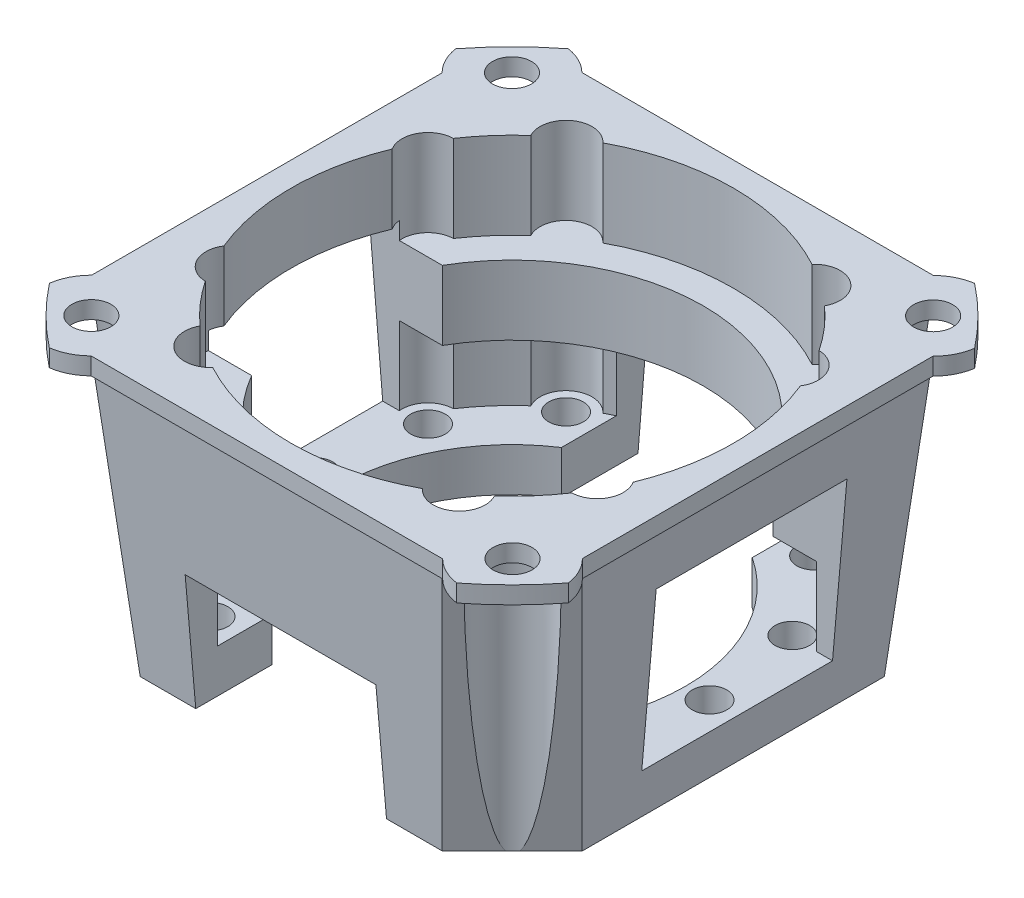
from build123d import *
from OCP.BRepFilletAPI import BRepFilletAPI_MakeChamfer

# Parameters (mm, degrees)
SKETCH1_W               = 29.5
SKETCH1_H               = 29.5
BOSS_EXTRUDE1_DEPTH     = 16
SKETCH2_R               = 12.75
CUT_EXTRUDE1_DEPTH      = 13.5
CHAMFER1_SIZE           = 22.860104606
CHAMFER1_SIZE_2         = 2
CHAMFER2_SIZE           = 4
CHAMFER2_SIZE2          = 4.030734246
SKETCH5_R               = 10
CUT_EXTRUDE2_DEPTH      = 10
BOSS_EXTRUDE2_START     = -1
BOSS_EXTRUDE2_DEPTH     = 1
MIRROR2_START           = -1
MIRROR2_COPY_1_DEPTH    = 1
CUT_EXTRUDE3_DEPTH      = 45.646312331
CUT_EXTRUDE3_DEPTH_BACK = 45.646312331
SKETCH7_R               = 1.125
SKETCH8_R               = 1
CUT_EXTRUDE4_DEPTH      = 45.992146034
SKETCH17_R              = 1.5
CUT_EXTRUDE12_DEPTH     = 13.5
SKETCH11_OUTSIDE_W      = 41.044
SKETCH11_OUTSIDE_H      = 41.014
SKETCH11_OUTSIDE_R      = 19
CUT_EXTRUDE6_DEPTH      = 45.992146034
SKETCH12_R              = 2
CUT_EXTRUDE7_DEPTH      = 15
SKETCH13_W              = 11
SKETCH13_H              = 30.855989766
CUT_EXTRUDE8_DEPTH      = 7
CUT_EXTRUDE9_DEPTH      = 45.557331201
CUT_EXTRUDE9_DEPTH_BACK = 45.557331201
SKETCH14_W              = 11
SKETCH14_H              = 9.5
BOSS_EXTRUDE4_START     = -4
BOSS_EXTRUDE4_DEPTH     = 4


with BuildPart() as part:
    # Sketch1 → Boss-Extrude1 (new body)
    with BuildSketch(Plane(origin=(0, 0, 0), x_dir=(1, 0, 0), z_dir=(0, 1, 0))):
        with Locations((14.75, 14.75)):
            Rectangle(SKETCH1_W, SKETCH1_H)
    extrude(amount=BOSS_EXTRUDE1_DEPTH)

    # Sketch2 → Cut-Extrude1 (cut)
    with BuildSketch(Plane(origin=(0, 16, 0), x_dir=(1, 0, 0), z_dir=(0, 1, 0))):
        with Locations(Location((14.75, 14.75, 0), (0, 0, 270))):
            Circle(SKETCH2_R)
    extrude(amount=-CUT_EXTRUDE1_DEPTH, mode=Mode.SUBTRACT)

    # Chamfer1
    # the kernel refuses this chamfer: 22.860104606, 2 mm, written as the material it takes off along each edge
    with BuildSketch(Plane(origin=(-59.427907001, 0, 0), x_dir=(0, 1, 0), z_dir=(1, 0, 0)), Plane(origin=(29.5, 0, 59.427907001), x_dir=(0, 1, 0), z_dir=(0, 0, -1)), Plane(origin=(0, 0, -88.927907001), x_dir=(0, 1, 0), z_dir=(0, 0, 1))) as chamfer1_piece_1:
        Polygon((CHAMFER1_SIZE, 0), (0, -CHAMFER1_SIZE_2), (0, 0), align=None)
    extrude(amount=148.355814002, mode=Mode.SUBTRACT)
    with BuildSketch(Plane(origin=(88.927907001, 0, -29.5), x_dir=(0, 0, 1), z_dir=(-1, 0, 0))) as chamfer1_piece_2:
        Polygon((CHAMFER1_SIZE_2, 0), (0, CHAMFER1_SIZE), (0, 0), align=None)
    extrude(amount=148.355814002, mode=Mode.SUBTRACT)

    # Chamfer2: one chamfer whose edges measure the first distance from different faces: ONE call of the kernel's chamfer builder (chamfer() names one face for all edges)
    chamfer2_edges_1 = [part.edges().sort_by_distance(p)[0] for p in [
        (1.300090692, 8, -28.199909308),
        (28.199909308, 8, -28.199909308),
    ]]
    chamfer2_side_1 = [part.faces().sort_by_distance(p)[0] for p in [
        (14.75, 8.13876858, -28.212049986),
    ]]
    chamfer2_edges_2 = [part.edges().sort_by_distance(p)[0] for p in [
        (1.300090692, 8, -1.300090692),
    ]]
    chamfer2_side_2 = [part.faces().sort_by_distance(p)[0] for p in [
        (1.287950014, 8.13876858, -14.75),
    ]]
    chamfer2_edges_3 = [part.edges().sort_by_distance(p)[0] for p in [
        (28.199909308, 8, -1.300090692),
    ]]
    chamfer2_side_3 = [part.faces().sort_by_distance(p)[0] for p in [
        (28.212049986, 8.13876858, -14.75),
    ]]
    chamfer2 = BRepFilletAPI_MakeChamfer(part.part.solid().wrapped)
    for e in chamfer2_edges_1:
        chamfer2.Add(CHAMFER2_SIZE, CHAMFER2_SIZE2, e.wrapped, chamfer2_side_1[0].wrapped)  # the first distance lies on this face
    for e in chamfer2_edges_2:
        chamfer2.Add(CHAMFER2_SIZE, CHAMFER2_SIZE2, e.wrapped, chamfer2_side_2[0].wrapped)  # the first distance lies on this face
    for e in chamfer2_edges_3:
        chamfer2.Add(CHAMFER2_SIZE, CHAMFER2_SIZE2, e.wrapped, chamfer2_side_3[0].wrapped)  # the first distance lies on this face
    add(Compound.cast(chamfer2.Shape()), mode=Mode.REPLACE)

    # Sketch5 → Cut-Extrude2 (cut)
    with BuildSketch(Plane.XZ):
        with Locations(Location((14.75, -14.734574622, 0), (0, 0, 270))):
            Circle(SKETCH5_R)
    extrude(amount=-CUT_EXTRUDE2_DEPTH, mode=Mode.SUBTRACT)

    # Boss-Extrude2: read off the stored shape, not the designer's step
    # Boss-Extrude2 outline → Boss-Extrude2 (add)
    with BuildSketch(Plane(origin=(0, 16, 0), x_dir=(1, 0, 0), z_dir=(0, 1, 0)).offset(BOSS_EXTRUDE2_START)):
        with BuildLine():
            Line((0.600181384, 4.615344889), (4.646195644, 0.600181384))
            Line((4.646195644, 0.600181384), (24.853804356, 0.600181384))
            Line((24.853804356, 0.600181384), (28.899818616, 4.615344889))
            Line((28.899818616, 4.615344889), (28.899818616, 24.853804356))
            Line((28.899818616, 24.853804356), (24.884655111, 28.899818616))
            Line((24.884655111, 28.899818616), (4.615344889, 28.899818616))
            ThreePointArc((4.615344889, 28.899818616), (0.584756006, 28.884393239), (0.600181384, 24.853804356))
            Line((0.600181384, 24.853804356), (0.600181384, 4.615344889))
        make_face()
        Polygon((24.797166447, 28.812329953), (28.812329953, 24.766315692), (28.812329953, 4.702833553), (24.766315692, 0.687670047), (4.733684308, 0.687670047), (0.687670047, 4.702833553), (0.687670047, 24.766315692), (4.702833553, 28.812329953), align=None, mode=Mode.SUBTRACT)
    boss_extrude2 = extrude(amount=BOSS_EXTRUDE2_DEPTH)

    # Mirror1: Boss-Extrude2 across plane
    add(boss_extrude2.mirror(Plane(origin=(14.75, 0, 0), x_dir=(0, 0, 1), z_dir=(1, 0, 0))))

    # Mirror2: Boss-Extrude2 across plane
    add(boss_extrude2.mirror(Plane.XY.offset(-14.75)))

    # Mirror2 copy 1 sketch → Mirror2 copy 1 (add)
    with BuildSketch(Plane(origin=(29.5, 16, -29.5), x_dir=(-1, 0, 0), z_dir=(0, 1, 0)).offset(MIRROR2_START)):
        with BuildLine():
            Line((0.600181384, 4.615344889), (4.646195644, 0.600181384))
            Line((4.646195644, 0.600181384), (24.853804356, 0.600181384))
            Line((24.853804356, 0.600181384), (28.899818616, 4.615344889))
            Line((28.899818616, 4.615344889), (28.899818616, 24.853804356))
            Line((28.899818616, 24.853804356), (24.884655111, 28.899818616))
            Line((24.884655111, 28.899818616), (4.615344889, 28.899818616))
            ThreePointArc((4.615344889, 28.899818616), (0.584756006, 28.884393239), (0.600181384, 24.853804356))
            Line((0.600181384, 24.853804356), (0.600181384, 4.615344889))
        make_face()
        Polygon((24.797166447, 28.812329953), (28.812329953, 24.766315692), (28.812329953, 4.702833553), (24.766315692, 0.687670047), (4.733684308, 0.687670047), (0.687670047, 4.702833553), (0.687670047, 24.766315692), (4.702833553, 28.812329953), align=None, mode=Mode.SUBTRACT)
    extrude(amount=MIRROR2_COPY_1_DEPTH)

    # Sketch7 → Cut-Extrude3 (cut, two sides: drawn at the far end of the back side and taken through both)
    with BuildSketch(Plane.XZ.offset(-15).offset(-CUT_EXTRUDE3_DEPTH_BACK)):
        with Locations(Location((2.607763136, -2.623188514, 0), (0, 0, 270))):
            Circle(SKETCH7_R)
        with Locations(Location((26.892236864, -2.623188514, 0), (0, 0, 308.909428046))):
            Circle(SKETCH7_R)
        with Locations(Location((26.892236864, -26.876811486, 0), (0, 0, 270))):
            Circle(SKETCH7_R)
        with Locations(Location((2.607763136, -26.876811486, 0), (0, 0, 270))):
            Circle(SKETCH7_R)
    extrude(amount=CUT_EXTRUDE3_DEPTH + CUT_EXTRUDE3_DEPTH_BACK, mode=Mode.SUBTRACT)

    # Sketch8 → Cut-Extrude4 (cut, through all)
    with BuildSketch(Plane.XZ):
        with Locations(Location((7.58, -4.521537889, 0), (0, 0, 270))):
            Circle(SKETCH8_R)
        with Locations(Location((4.219388969, -9.118549755, 0), (0, 0, 270))):
            Circle(SKETCH8_R)
        with Locations(Location((7.604770426, -24.995781156, 0), (0, 0, 270))):
            Circle(SKETCH8_R)
        with Locations(Location((21.944728448, -24.96108318, 0), (0, 0, 270))):
            Circle(SKETCH8_R)
        with Locations(Location((25.294206418, -20.355953224, 0), (0, 0, 270))):
            Circle(SKETCH8_R)
        with Locations(Location((21.92, -4.521537889, 0), (0, 0, 270))):
            Circle(SKETCH8_R)
        with Locations(Location((3.375033299, -14.777523673, 0), (0, 0, 90))):
            Circle(SKETCH8_R)
        with Locations(Location((4.233046011, -20.406914295, 0), (0, 0, 245.746224718))):
            Circle(SKETCH8_R)
        with Locations(Location((26.125, -14.75, 0), (0, 0, 90))):
            Circle(SKETCH8_R)
        with Locations(Location((25.280611031, -9.118549755, 0), (0, 0, 350.665442319))):
            Circle(SKETCH8_R)
    extrude(amount=-CUT_EXTRUDE4_DEPTH, mode=Mode.SUBTRACT)

    # Sketch17 → Cut-Extrude12 (cut)
    with BuildSketch(Plane(origin=(0, 2.5, 0), x_dir=(1, 0, 0), z_dir=(0, 1, 0))):
        with Locations((7.604770426, 24.995781156)):
            Circle(SKETCH17_R)
        with Locations((4.233046011, 20.406914295)):
            Circle(SKETCH17_R)
        with Locations((4.219388969, 9.118549755)):
            Circle(SKETCH17_R)
        with Locations((7.58, 4.521537889)):
            Circle(SKETCH17_R)
        with Locations((21.92, 4.521537889)):
            Circle(SKETCH17_R)
        with Locations((25.280611031, 9.118549755)):
            Circle(SKETCH17_R)
        with Locations((25.294206418, 20.355953224)):
            Circle(SKETCH17_R)
        with Locations((21.944728448, 24.96108318)):
            Circle(SKETCH17_R)
    extrude(amount=CUT_EXTRUDE12_DEPTH, mode=Mode.SUBTRACT)

    # Sketch11 outside → Cut-Extrude6 (cut, through all)
    with BuildSketch(Plane.XZ):
        with Locations((14.75, -14.75)):
            Rectangle(SKETCH11_OUTSIDE_W, SKETCH11_OUTSIDE_H)
        with Locations((14.75, -14.734574622)):
            Circle(SKETCH11_OUTSIDE_R, mode=Mode.SUBTRACT)
    extrude(amount=-CUT_EXTRUDE6_DEPTH, mode=Mode.SUBTRACT)

    # Sketch12 → Cut-Extrude7 (cut)
    with BuildSketch(Plane.XZ):
        with Locations((2.607763136, -2.623188514)):
            Circle(SKETCH12_R)
        with Locations((26.892236864, -2.623188514)):
            Circle(SKETCH12_R)
        with Locations((26.892236864, -26.876811486)):
            Circle(SKETCH12_R)
        with Locations((2.607763136, -26.876811486)):
            Circle(SKETCH12_R)
    extrude(amount=-CUT_EXTRUDE7_DEPTH, mode=Mode.SUBTRACT)

    # Sketch13 → Cut-Extrude8 (cut)
    with BuildSketch(Plane.XZ):
        with Locations((14.75, -15.427994883)):
            Rectangle(SKETCH13_W, SKETCH13_H)
    extrude(amount=-CUT_EXTRUDE8_DEPTH, mode=Mode.SUBTRACT)

    # Sketch14 → Cut-Extrude9 (cut, two sides: drawn at the far end of the back side and taken through both)
    with BuildSketch(Plane(origin=(0.600181384, 0, 0), x_dir=(0, 0, -1), z_dir=(1, 0, 0)).offset(-CUT_EXTRUDE9_DEPTH_BACK)):
        with Locations((14.747577474, 7.25)):
            Rectangle(SKETCH14_W, SKETCH14_H)
    extrude(amount=CUT_EXTRUDE9_DEPTH + CUT_EXTRUDE9_DEPTH_BACK, mode=Mode.SUBTRACT)

    # Boss-Extrude4: read off the stored shape, not the designer's step
    # Boss-Extrude4 outline → Boss-Extrude4 (add)
    with BuildSketch(Plane(origin=(0, 11, 0), x_dir=(1, 0, 0), z_dir=(0, 1, 0)).offset(BOSS_EXTRUDE4_START)):
        with BuildLine():
            Line((26.775051343, 9.247577474), (24.274880385, 9.247577474))
            ThreePointArc((24.274880385, 9.247577474), (14.75, 3.75), (5.225119615, 9.247577474))
            Line((5.225119615, 9.247577474), (2.724948657, 9.247577474))
            ThreePointArc((2.724948657, 9.247577474), (3.101034316, 8.118908385), (4.18060697, 7.619051187))
            ThreePointArc((4.18060697, 7.619051187), (5.146820144, 6.363019814), (6.261378349, 5.236546239))
            ThreePointArc((6.261378349, 5.236546239), (6.718994568, 3.293258749), (8.701845126, 3.52581528))
            ThreePointArc((8.701845126, 3.52581528), (14.75, 2), (20.798154874, 3.52581528))
            ThreePointArc((20.798154874, 3.52581528), (22.781005432, 3.293258749), (23.238621651, 5.236546239))
            ThreePointArc((23.238621651, 5.236546239), (24.353179856, 6.363019814), (25.31939303, 7.619051187))
            ThreePointArc((25.31939303, 7.619051187), (26.398965684, 8.118908385), (26.775051343, 9.247577474))
        make_face()
        with BuildLine():
            Line((24.277677677, 20.247577474), (26.790286194, 20.247577474))
            ThreePointArc((26.790286194, 20.247577474), (26.406849135, 21.361948346), (25.336616586, 21.855353563))
            ThreePointArc((25.336616586, 21.855353563), (24.373445414, 23.11371917), (23.261616159, 24.242886303))
            ThreePointArc((23.261616159, 24.242886303), (22.808703381, 26.187275382), (20.825295919, 25.959517362))
            ThreePointArc((20.825295919, 25.959517362), (14.78085071, 27.499962676), (8.729021582, 25.988786362))
            ThreePointArc((8.729021582, 25.988786362), (6.746739537, 26.226140044), (6.284422555, 24.28396552))
            ThreePointArc((6.284422555, 24.28396552), (5.167141926, 23.160192099), (4.197892408, 21.906502313))
            ThreePointArc((4.197892408, 21.906502313), (3.105798999, 21.396517333), (2.74153276, 20.247577474))
            Line((2.74153276, 20.247577474), (5.222322323, 20.247577474))
            ThreePointArc((5.222322323, 20.247577474), (14.75, 25.75), (24.277677677, 20.247577474))
        make_face()
    extrude(amount=BOSS_EXTRUDE4_DEPTH)


solid = part.part
